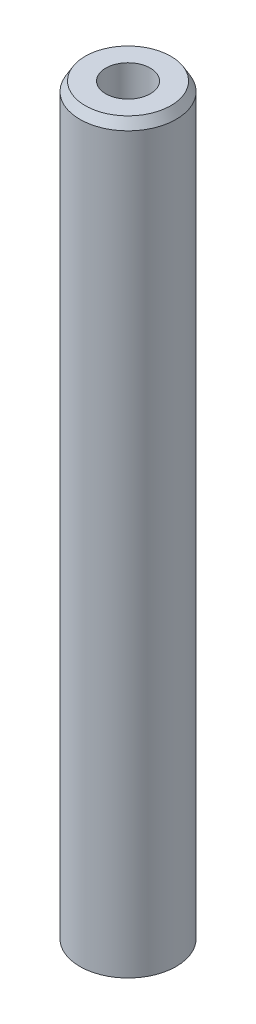
from build123d import *
from OCP.BRepFilletAPI import BRepFilletAPI_MakeChamfer

# Parameters (mm, degrees)
SKETCH1_R           = 15
BOSS_EXTRUDE1_DEPTH = 233.122431273
SKETCH2_R           = 6.946676681
CUT_EXTRUDE1_DEPTH  = 235.085599648
CHAMFER1_SIZE       = 2.87085672
CHAMFER1_SIZE2      = 1.6574899


with BuildPart() as part:
    # Sketch1 → Boss-Extrude1 (new body)
    with BuildSketch(Plane(origin=(0, 0, 0), x_dir=(1, 0, 0), z_dir=(0, 1, 0))):
        Circle(SKETCH1_R)
    extrude(amount=BOSS_EXTRUDE1_DEPTH)

    # Sketch2 → Cut-Extrude1 (cut, through all)
    with BuildSketch(Plane(origin=(0, 0, 0), x_dir=(1, 0, 0), z_dir=(0, 1, 0))):
        Circle(SKETCH2_R)
    extrude(amount=CUT_EXTRUDE1_DEPTH, mode=Mode.SUBTRACT)

    # Chamfer1: one chamfer whose edges measure the first distance from different faces: ONE call of the kernel's chamfer builder (chamfer() names one face for all edges)
    chamfer1_edges_1 = [part.edges().sort_by_distance(p)[0] for p in [
        (-15, 233.122431273, 0),
    ]]
    chamfer1_side_1 = [part.faces().sort_by_distance(p)[0] for p in [
        (-15, 116.561215636, 0),
    ]]
    chamfer1_edges_2 = [part.edges().sort_by_distance(p)[0] for p in [
        (-15, 0, 0),
    ]]
    chamfer1_side_2 = [part.faces().sort_by_distance(p)[0] for p in [
        (-14.575735931, 0, 0),
    ]]
    chamfer1 = BRepFilletAPI_MakeChamfer(part.part.solid().wrapped)
    for e in chamfer1_edges_1:
        chamfer1.Add(CHAMFER1_SIZE, CHAMFER1_SIZE2, e.wrapped, chamfer1_side_1[0].wrapped)  # the first distance lies on this face
    for e in chamfer1_edges_2:
        chamfer1.Add(CHAMFER1_SIZE, CHAMFER1_SIZE2, e.wrapped, chamfer1_side_2[0].wrapped)  # the first distance lies on this face
    add(Compound.cast(chamfer1.Shape()), mode=Mode.REPLACE)


solid = part.part
